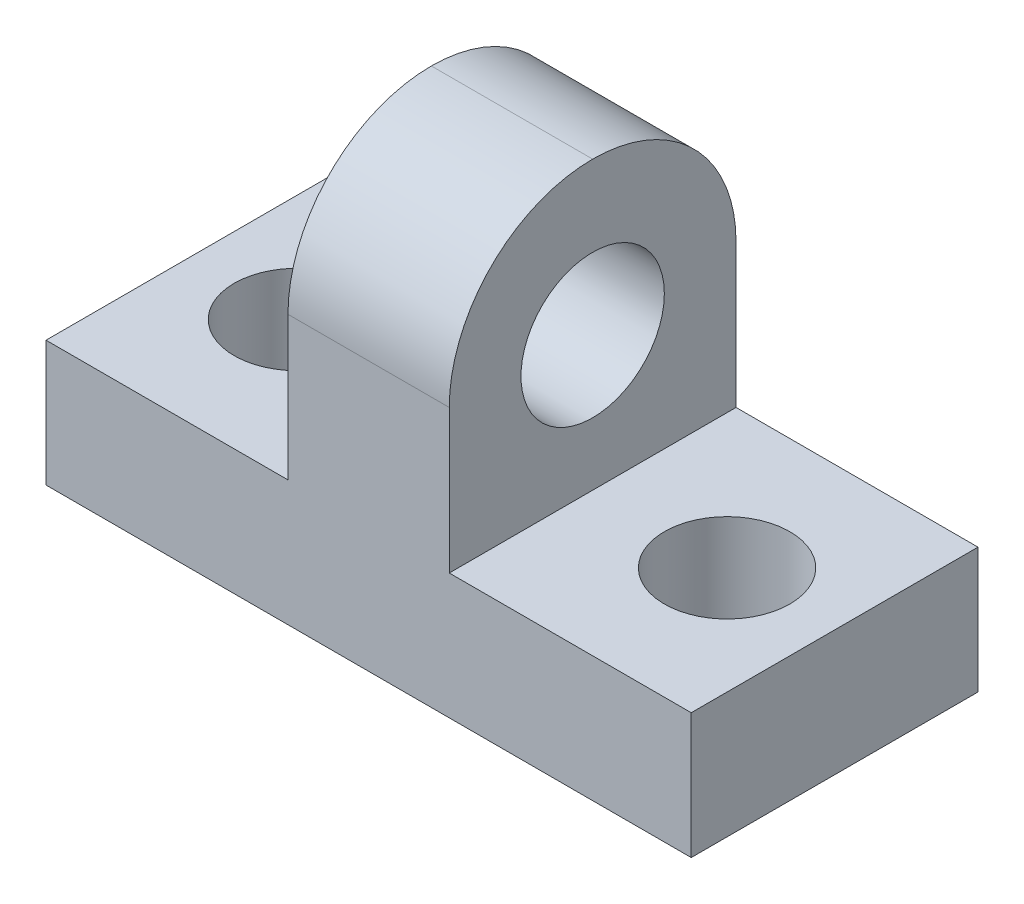
from build123d import *

# Parameters (mm, degrees)
BOSS_EXTRUDE1_DEPTH = 16
FILLET1_R           = 16
SKETCH6_R           = 7
CUT_EXTRUDE3_DEPTH  = 14
SKETCH3_R           = 8
CUT_EXTRUDE2_DEPTH  = 18


with BuildPart() as part:
    # Sketch1 → Boss-Extrude1 (new, symmetric)
    with BuildSketch(Plane.XY):
        Polygon((36, 0), (-36, 0), (-36, 14), (-9, 14), (-9, 46), (9, 46), (9, 14), (36, 14), align=None)
    extrude(amount=BOSS_EXTRUDE1_DEPTH, both=True)

    # Fillet1
    fillet1_edges = [part.edges().sort_by_distance(p)[0] for p in [
        (0, 46, -16),
        (0, 46, 16),
    ]]
    fillet(fillet1_edges, radius=FILLET1_R - 0.0001)  # a hair under: the kernel refuses the full size

    # Sketch6 → Cut-Extrude3 (cut)
    with BuildSketch(Plane(origin=(0, 14, 0), x_dir=(1, 0, 0), z_dir=(0, 1, 0))):
        with Locations(Location((-24, 0, 0), (0, 0, 180))):
            Circle(SKETCH6_R)
        with Locations((24, 0)):
            Circle(SKETCH6_R)
    extrude(amount=-CUT_EXTRUDE3_DEPTH, mode=Mode.SUBTRACT)

    # Sketch3 → Cut-Extrude2 (cut)
    with BuildSketch(Plane(origin=(9, 0, 0), x_dir=(0, 0, -1), z_dir=(1, 0, 0))):
        with Locations((0, 29)):
            Circle(SKETCH3_R)
    extrude(amount=-CUT_EXTRUDE2_DEPTH, mode=Mode.SUBTRACT)


solid = part.part
